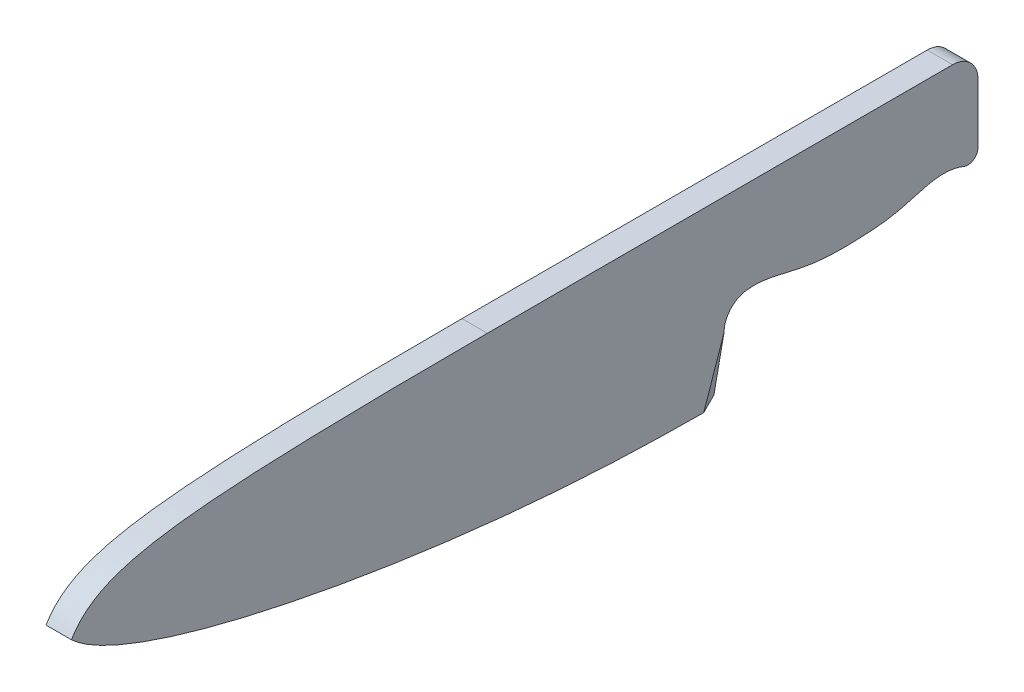
from build123d import *

# Parameters (mm, degrees)
EXTRUDE_1_DEPTH          = 5
FILLET_6_R               = 5
FILLET_7_R               = 2
FILLET_8_R               = 5
CUT_EXTRUDE_1_DEPTH      = 185.424559073
CUT_EXTRUDE_1_DEPTH_BACK = 185.424559073
SKETCH_6_W               = 27.094284284
SKETCH_6_H               = 20.392851323
CUT_EXTRUDE_2_DEPTH      = 164.712248904
SKETCH_7_W               = 91.771448639
SKETCH_7_H               = 20.028601632
CUT_EXTRUDE_3_DEPTH      = 167.349688769


# Read off the part's stored shape, not the designer's step: 凸台-拉伸1
with BuildPart() as part:
    # 凸台-拉伸1 outline → 凸台-拉伸1 (new body)
    with BuildSketch(Plane(origin=(0, 0, 0), x_dir=(0, 0, -1), z_dir=(1, 0, 0))):
        with BuildLine():
            add(Edge.make_bspline(
                [(0, -14.903846424), (2.951295662, -4.14849373), (13.496276672, -1.883966721), (29.52909514, 0), (83.401333812, 0)],
                knots=[0, 0, 0, 0, 0, 1, 1, 1, 1, 1], degree=4))
            add(Edge.make_bspline(
                [(0, -14.903846424), (13.738939295, -26.332723654), (29.4774768, -32.710998586), (74.674999713, -39.156033076), (130, -39.931386408)],
                knots=[0, 0, 0, 0, 0, 0.958214361, 0.958214361, 0.958214361, 0.958214361, 0.958214361], degree=4))
            Line((130, -39.931386408), (130, -20))
            add(Edge.make_bspline(
                [(130, -20), (142.554964398, -11.053747082), (149.196912904, -34.934175524), (158.630756241, -5.373255264), (163.289648635, -33.936740498), (166.072200522, -10.144868391), (180, -20)],
                knots=[0, 0, 0, 0, 0, 0, 0, 1, 1, 1, 1, 1, 1, 1], degree=6))
            Line((180, -20), (180, 0))
            Line((180, 0), (83.401333812, 0))
        make_face()
    extrude(amount=EXTRUDE_1_DEPTH)

    # 圆角6
    fillet_6_edges = [part.edges().sort_by_distance(p)[0] for p in [
        (2.5, -20, -130),
    ]]
    fillet(fillet_6_edges, radius=FILLET_6_R)

    # 圆角7
    fillet_7_edges = [part.edges().sort_by_distance(p)[0] for p in [
        (2.5, -20, -180),
    ]]
    fillet(fillet_7_edges, radius=FILLET_7_R)

    # 圆角8
    fillet_8_edges = [part.edges().sort_by_distance(p)[0] for p in [
        (2.5, 0, -180),
        (2.5, -39.931386408, -130),
    ]]
    fillet(fillet_8_edges, radius=FILLET_8_R)

    # 草图4 → 切除-拉伸1 (cut, two sides: drawn at the far end of the back side and taken through both)
    with BuildSketch(Plane(origin=(5, 0, 0), x_dir=(0, 0, -1), z_dir=(1, 0, 0)).offset(-CUT_EXTRUDE_1_DEPTH_BACK)):
        with BuildLine():
            add(Edge.make_bspline(
                [(1.495142471, -11.305529877), (14.835007519, -23.95714683), (75.592167753, -33.882807925), (104.343520452, -34.842413885), (130, -34.842413885)],
                knots=[0, 0, 0, 0, 0, 1, 1, 1, 1, 1], degree=4))
            add(Edge.make_bspline(
                [(0, -14.903846424), (0.275551051, -13.899660779), (0.617298034, -12.969491649), (1.023527011, -12.106738133), (1.495142471, -11.305529877)],
                knots=[0, 0, 0, 0, 0, 0.093366129, 0.093366129, 0.093366129, 0.093366129, 0.093366129], degree=4))
            add(Edge.make_bspline(
                [(0, -14.903846424), (13.419828476, -26.067268054), (28.7474456, -32.411980768), (71.57295957, -38.706985512), (124.893658481, -39.841282905)],
                knots=[0, 0, 0, 0, 0, 0.935958162, 0.935958162, 0.935958162, 0.935958162, 0.935958162], degree=4))
            add(Edge.make_bspline(
                [(130, -34.842413884), (130, -35.028759319), (129.99166601, -35.216258569), (129.974804907, -35.404332472), (129.94928895, -35.592386619), (129.915057389, -35.77981586), (129.841480351, -36.098859681), (129.806409214, -36.231082745), (129.766907364, -36.362456276), (129.722994517, -36.492760695), (129.674707397, -36.621778563), (129.58487848, -36.839515421), (129.545494286, -36.928984789), (129.503966151, -37.017626664), (129.46031708, -37.10536636), (129.414574093, -37.192130532), (129.250587102, -37.486161652), (129.122218575, -37.688294916), (128.98211374, -37.883204904), (128.830848248, -38.069925037), (128.669117931, -38.247570978), (128.255836276, -38.652154349), (127.994673555, -38.869333518), (127.716552177, -39.064613196), (127.424118002, -39.236250049), (127.120264983, -39.382959218), (126.679539096, -39.553907949), (126.549523427, -39.599440156), (126.418314531, -39.640571717), (126.286130578, -39.677270539), (126.153191519, -39.709521582), (125.832655006, -39.776296457), (125.644540113, -39.806533973), (125.455985822, -39.828044566), (125.267595854, -39.840901842), (125.079961766, -39.845246156), (124.893658481, -39.841282905)],
                knots=[0, 0, 0, 0, 0, 0, 0, 0.145130031, 0.145130031, 0.145130031, 0.145130031, 0.145130031, 0.248682026, 0.248682026, 0.248682026, 0.248682026, 0.248682026, 0.321947701, 0.321947701, 0.321947701, 0.321947701, 0.321947701, 0.500002972, 0.500002972, 0.500002972, 0.500002972, 0.500002972, 0.751317975, 0.751317975, 0.751317975, 0.751317975, 0.751317975, 0.85486997, 0.85486997, 0.85486997, 0.85486997, 0.85486997, 1, 1, 1, 1, 1, 1, 1], degree=6))
        make_face()
    extrude(amount=CUT_EXTRUDE_1_DEPTH + CUT_EXTRUDE_1_DEPTH_BACK, mode=Mode.SUBTRACT)

    # 草图6 → 切除-拉伸2 (cut, through all)
    with BuildSketch(Plane(origin=(57.793484303, -9.892917122, -28.873774023), x_dir=(-0.4401729492006857, 0.04581450966450186, -0.8967434446351822), z_dir=(0.88426202268349, -0.1513653487033851, -0.4417795903520281))):
        with Locations((120.420599257, -28.887536231)):
            Rectangle(SKETCH_6_W, SKETCH_6_H)
    extrude(amount=CUT_EXTRUDE_2_DEPTH, mode=Mode.SUBTRACT)

    # 草图7 → 切除-拉伸3 (cut, through all)
    with BuildSketch(Plane(origin=(-53.53520172, -9.024374029, -26.444544598), x_dir=(-0.43181481098590574, -0.07279057966413091, 0.8990203003966966), z_dir=(-0.886513170069574, -0.14943861555354754, -0.437906952987314))):
        with Locations((-105.176126902, -32.909539251)):
            Rectangle(SKETCH_7_W, SKETCH_7_H)
    extrude(amount=CUT_EXTRUDE_3_DEPTH, mode=Mode.SUBTRACT)


solid = part.part
